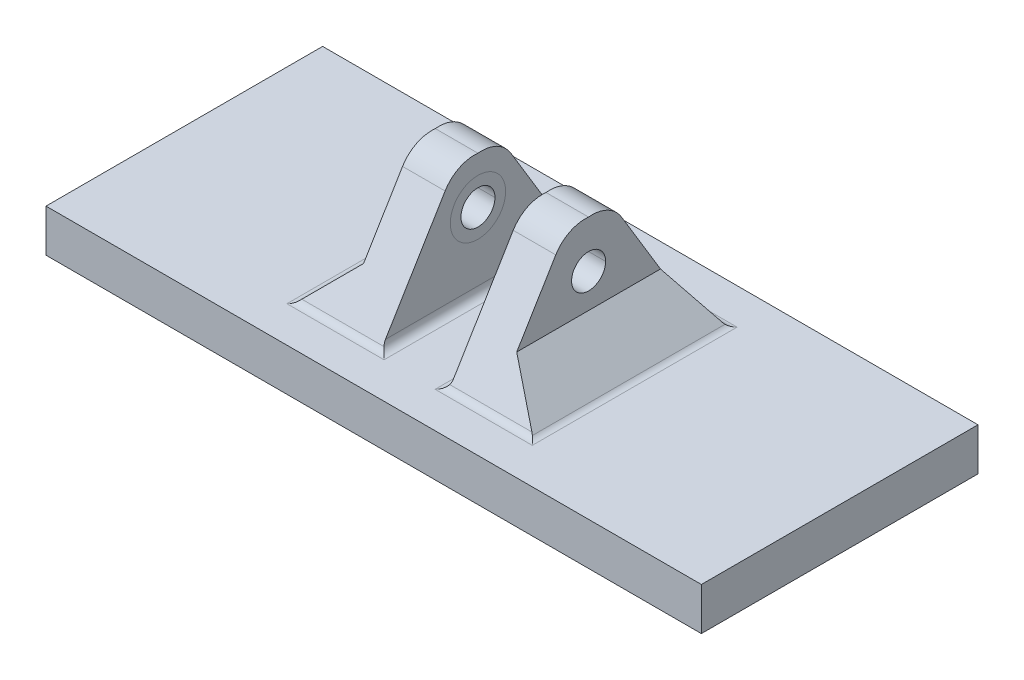
from build123d import *

# Parameters (mm, degrees)
SKETCH1_W           = 154
SKETCH1_H           = 65
BOSS_EXTRUDE1_DEPTH = 10
BOSS_EXTRUDE2_START = 8
SKETCH2_R           = 4
BOSS_EXTRUDE2_DEPTH = 10
CHAMFER1_SIZE       = 10
FILLET2_R           = 2


with BuildPart() as part:
    # Sketch1 → Boss-Extrude1 (new body)
    with BuildSketch(Plane(origin=(0, 0, 0), x_dir=(1, 0, 0), z_dir=(0, 1, 0))):
        Rectangle(SKETCH1_W, SKETCH1_H)
    extrude(amount=BOSS_EXTRUDE1_DEPTH)

    # Sketch2 → Boss-Extrude2 (add)
    with BuildSketch(Plane(origin=(0, 0, 0), x_dir=(0, 0, -1), z_dir=(1, 0, 0)).offset(BOSS_EXTRUDE2_START)):
        with BuildLine():
            Line((-22.934523003, 10), (-7.714285949, 35.180316317))
            ThreePointArc((-7.714285949, 35.180316317), (-4.414778361, 38.221001797), (0, 39.022407146))
            ThreePointArc((0, 39.022407146), (4.414778361, 38.221001797), (7.714285949, 35.180316317))
            Line((7.714285949, 35.180316317), (22.934523003, 10))
            Line((22.934523003, 10), (-22.934523003, 10))
        make_face()
        with Locations((0, 28)):
            Circle(SKETCH2_R, mode=Mode.SUBTRACT)
    boss_extrude2 = extrude(amount=BOSS_EXTRUDE2_DEPTH)

    # Mirror1: Boss-Extrude2 across plane
    add(boss_extrude2.mirror(Plane(origin=(0, 0, 0), x_dir=(0, 0, 1), z_dir=(1, 0, 0))))

    # Chamfer1
    chamfer1_edges = [part.edges().sort_by_distance(p)[0] for p in [
        (18, 10, 0),
        (-18, 10, 0),
    ]]
    chamfer(chamfer1_edges, length=CHAMFER1_SIZE)

    # Fillet2
    fillet2_edges = [part.edges().sort_by_distance(p)[0] for p in [
        (8, 10, 0),
        (18, 10, -22.934523003),
        (28, 10, 0),
        (18, 10, 22.934523003),
        (-18, 10, 22.934523003),
        (-8, 10, 0),
        (-18, 10, -22.934523003),
        (-28, 10, 0),
    ]]
    fillet(fillet2_edges, radius=FILLET2_R)


solid = part.part
